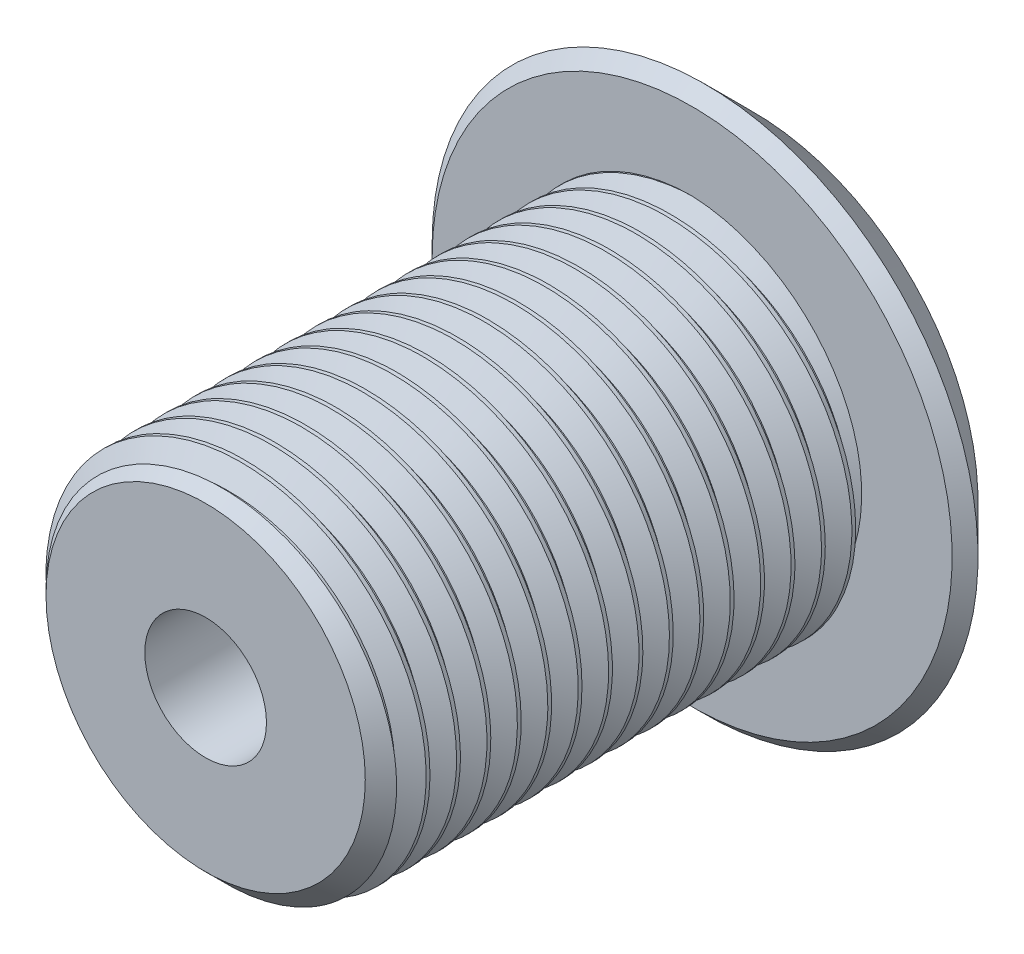
from build123d import *

# Parameters (mm, degrees)
SKETCH1_R                   = 9.525
EXTRUDE1_DEPTH              = 25.4
CHAMFER3_SIZE               = 1.190625
CUT_SWEEP1_PITCH            = 1.5875
SKETCH6_R                   = 14.2875
EXTRUDE2_DEPTH              = 19.05
CUT_EXTRUDE1_DEPTH          = 11.90625
CHAMFER1_SIZE               = 1.42875
CHAMFER2_SIZE               = 0.714375
CUT_EXTRUDE3_START          = -15.875
SKETCH10_R                  = 14.2875
CUT_EXTRUDE3_DEPTH          = 15.875
F_1_4_0_25_DIAMETER_HOLE1_D = 6.35
CHAMFER4_SIZE               = 2.54


with BuildPart() as part:
    # Sketch1 → Extrude1 (new body)
    with BuildSketch(Plane.XY):
        Circle(SKETCH1_R)
    extrude(amount=-EXTRUDE1_DEPTH)

    # Chamfer3
    chamfer3_edges = [part.edges().sort_by_distance(p)[0] for p in [
        (-9.525, 0, 0),
    ]]
    chamfer(chamfer3_edges, length=CHAMFER3_SIZE)

    # Cut-Sweep1: the profile of Sketch3 profile screwed along a right-hand helix of 17 turns, 6 arcs to a turn; built about Z, then put on its axis
    cut_sweep1_z = Axis((0, 0, 0), (0, 0, 1))
    cut_sweep1_corners = [(9.5253, 0, -1.389235705), (8.493888504, 0, -0.79375), (8.493888504, 0, -0.5953125), (9.5253, 0, 0.000173205)]
    with BuildLine(mode=Mode.PRIVATE) as cut_sweep1_profile:
        Line(cut_sweep1_corners[0], cut_sweep1_corners[1])
        Line(cut_sweep1_corners[1], cut_sweep1_corners[2])
        Line(cut_sweep1_corners[2], cut_sweep1_corners[3])
        Line(cut_sweep1_corners[3], cut_sweep1_corners[0])
    cut_sweep1_cap = Face(cut_sweep1_profile.wire())
    cut_sweep1_turn_angles = [0, 30, 60, 90, 120, 150, 180, 210, 240, 270, 300, 330, 360]
    cut_sweep1_turn_weights = [1, 0.8660254037844387, 1, 0.8660254037844387, 1, 0.8660254037844387, 1, 0.8660254037844387, 1, 0.8660254037844387, 1, 0.8660254037844387, 1]
    cut_sweep1_turn_rails = [Edge.make_bspline([Vector(p[0], p[1], 0).rotate(cut_sweep1_z, cut_sweep1_turn_angles[k]) / cut_sweep1_turn_weights[k] + Vector(0, 0, p[2] + CUT_SWEEP1_PITCH * cut_sweep1_turn_angles[k] / 360) for k in range(13)], [0, 0, 0, 1, 1, 2, 2, 3, 3, 4, 4, 5, 5, 6, 6, 6], 2, cut_sweep1_turn_weights) for p in cut_sweep1_corners]
    cut_sweep1_turn_sides = [Face.make_surface_from_curves(cut_sweep1_turn_rails[p[0]], cut_sweep1_turn_rails[p[1]]) for p in [(0, 1), (1, 2), (2, 3), (3, 0)]]
    cut_sweep1 = Plane(origin=(0, 0, 0), x_dir=(0, 1, 0), z_dir=(0, 0, -1)) * Solid(Shell([*[p.moved(Location((0, 0, CUT_SWEEP1_PITCH * i))) for i in range(17) for p in cut_sweep1_turn_sides], cut_sweep1_cap, cut_sweep1_cap.rotate(cut_sweep1_z, 6120).moved(Location((0, 0, CUT_SWEEP1_PITCH * 6120 / 360)))]))
    add(cut_sweep1, mode=Mode.SUBTRACT)

    # Sketch6 → Extrude2 (add)
    with BuildSketch(Plane(origin=(0, 0, -25.4), x_dir=(-1, 0, 0), z_dir=(0, 0, -1))):
        with Locations(Location((0, 0, 0), (0, 0, 180))):
            Circle(SKETCH6_R)
    extrude(amount=EXTRUDE2_DEPTH)

    # Sketch7 → Cut-Extrude1 (cut)
    with BuildSketch(Plane(origin=(0, 0, -44.45), x_dir=(-1, 0, 0), z_dir=(0, 0, -1))):
        Polygon((0, 9.165435523), (-7.9375, 4.582717762), (-7.9375, -4.582717762), (0, -9.165435523), (7.9375, -4.582717762), (7.9375, 4.582717762), align=None)
    extrude(amount=-CUT_EXTRUDE1_DEPTH, mode=Mode.SUBTRACT)

    # Cut-Extrude2 cone 1 section (through the dimple's axis) → Cut-Extrude2 (revolve, cut)
    with BuildSketch(Plane(origin=(0, 0, -44.45), x_dir=(0, 1, 0), z_dir=(1, 0, 0))):
        Polygon((0, 0), (9.165435523, 0), (0, 9.165435523), align=None)
    revolve(axis=Axis((0, 0, -44.45), (0, 0, 1)), mode=Mode.SUBTRACT)

    # Chamfer1
    chamfer1_edges = [part.edges().sort_by_distance(p)[0] for p in [
        (-14.2875, 0, -44.45),
    ]]
    chamfer(chamfer1_edges, length=CHAMFER1_SIZE)

    # Chamfer2
    chamfer2_edges = [part.edges().sort_by_distance(p)[0] for p in [
        (-14.2875, 0, -25.4),
    ]]
    chamfer(chamfer2_edges, length=CHAMFER2_SIZE)

    # Sketch10 → Cut-Extrude3 (cut)
    with BuildSketch(Plane(origin=(0, 0, -44.45), x_dir=(-1, 0, 0), z_dir=(0, 0, -1)).offset(CUT_EXTRUDE3_START)):
        with Locations(Location((0, 0, 0), (0, 0, 180))):
            Circle(SKETCH10_R)
    extrude(amount=CUT_EXTRUDE3_DEPTH, mode=Mode.SUBTRACT)

    # 1/4 (0.25) Diameter Hole1 (through all)
    with Locations(Plane(origin=(0, 0, -28.575), x_dir=(-1, 0, 0), z_dir=(0, 0, -1))):
        with Locations((0, 0)):
            Hole(F_1_4_0_25_DIAMETER_HOLE1_D / 2)

    # Chamfer4
    # the kernel refuses this chamfer: 2.54 mm, written as the material it takes off along each edge
    with BuildSketch(Plane(origin=(0, 0, -28.575), x_dir=(1, 0, 0), z_dir=(0, 1, 0))) as chamfer4_piece_1:
        Polygon((14.2875, -CHAMFER4_SIZE), (14.2875 - CHAMFER4_SIZE, 0), (14.2875, 0), align=None)
    revolve(axis=Axis((0, 0, -28.575), (0, 0, -1)), mode=Mode.SUBTRACT)


solid = part.part
